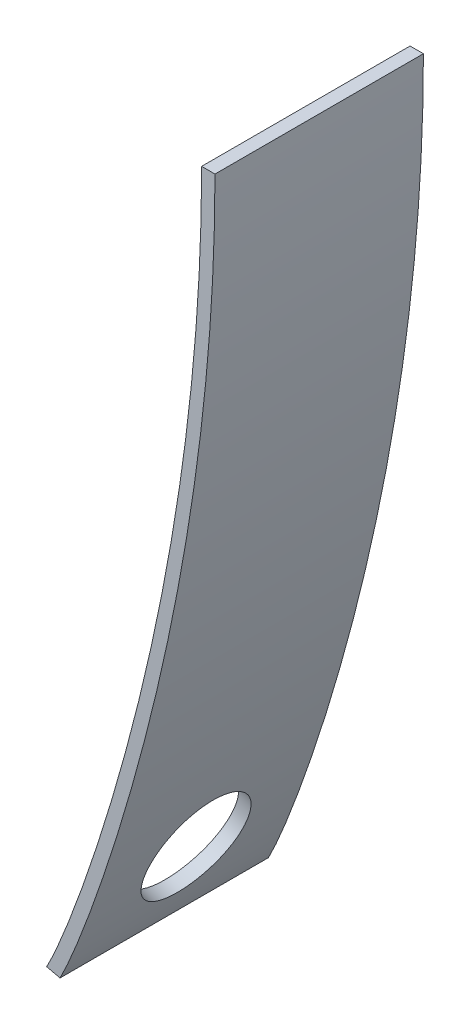
from build123d import *

# Parameters (mm, degrees)
BOSS_EXTRUDE1_DEPTH = 15.875
SKETCH3_R           = 3.96875
CUT_EXTRUDE1_DEPTH  = 56.220831813


with BuildPart() as part:
    # Sketch1 → Boss-Extrude1 (new body)
    with BuildSketch(Plane.XY):
        with BuildLine():
            Line((-1.016, 29.355277439), (0, 29.355277439))
            add(Edge.make_bspline(
                [(0, 29.355277439), (0, 0), (-9.599644928, -25.418345845), (-11.80014336, -29.574736835)],
                knots=[0, 0, 0, 0, 1, 1, 1, 1], degree=3))
            Line((-11.80014336, -29.574736835), (-12.82390686, -29.337045136))
            Line((-12.82390686, -29.337045136), (-12.698066868, -29.099353437))
            add(Edge.make_bspline(
                [(-1.016, 29.355277439), (-1.016, 27.550326556), (-1.090433728, 23.915187486), (-1.504306808, 16.855354767), (-2.457039545, 8.361518974), (-4.099428394, -1.056476565), (-6.042674076, -9.505599636), (-7.747097747, -15.565843862), (-9.061893662, -19.723126975), (-9.998550617, -22.469633369), (-10.860488882, -24.818373274), (-11.495244143, -26.421861441), (-11.9392839, -27.477329912), (-12.237192952, -28.15188839), (-12.451060525, -28.609168554), (-12.602329361, -28.915317146), (-12.664333464, -29.035636411), (-12.698066868, -29.099353437)],
                knots=[0, 0, 0, 0, 0.0625, 0.125, 0.25, 0.375, 0.5, 0.625, 0.6875, 0.75, 0.8125, 0.875, 0.90625, 0.9375, 0.96875, 0.984375, 1, 1, 1, 1], degree=3))
        make_face()
    extrude(amount=BOSS_EXTRUDE1_DEPTH)

    # Sketch3 → Cut-Extrude1 (cut, through all)
    with BuildSketch(Plane(origin=(-9.637227011, -24.424781037, 8.010581608), x_dir=(0, 0, -1), z_dir=(0.9374409407787941, -0.3481443415478265, 0))):
        with Locations((0.073081608, 0.769213504)):
            Circle(SKETCH3_R)
    extrude(amount=-CUT_EXTRUDE1_DEPTH, mode=Mode.SUBTRACT)


solid = part.part
